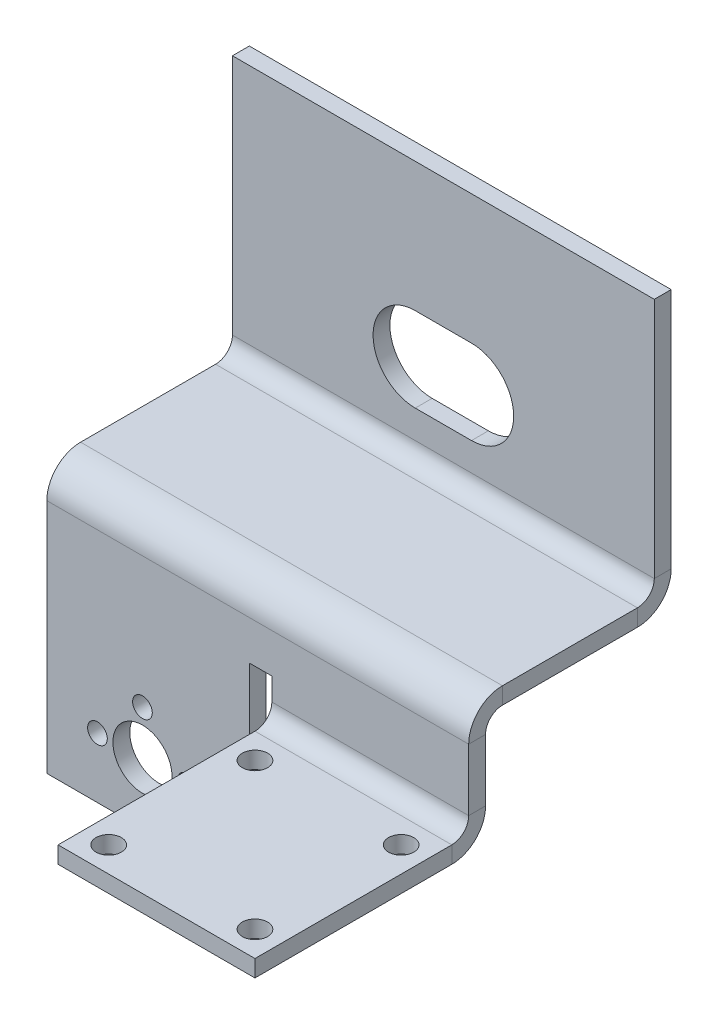
from build123d import *

# Parameters (mm, degrees)
SKETCH1_W                    = 35
SKETCH1_H                    = 35
SKETCH1_R                    = 2.25
BASE_FLANGE1_DEPTH           = 3
EDGE_FLANGE1_DEPTH           = 35
SKETCH9_W                    = 36
SKETCH9_H                    = 35
BOSS_EXTRUDE1_DEPTH          = 3
EDGE_FLANGE2_STRIP_W         = 18
EDGE_FLANGE2_STRIP_H         = 3
EDGE_FLANGE2_STRIP_CUT_DEPTH = 75
EDGE_FLANGE2_DEPTH           = 75
EDGE_FLANGE3_STRIP_W         = 18
EDGE_FLANGE3_STRIP_H         = 3
EDGE_FLANGE3_STRIP_CUT_DEPTH = 75
EDGE_FLANGE3_DEPTH           = 75
SKETCH16_R                   = 5.25
SKETCH16_R_2                 = 1.75
CUT_EXTRUDE1_DEPTH           = 10
CUT_EXTRUDE2_DEPTH           = 10
BODY_MOVE_COPY1_ANGLE        = 180


# Sheet-metal steps are written as plain solids
with BuildPart() as part:
    # Sketch1 → Base-Flange1 (new body)
    with BuildSketch(Plane.XY):
        Rectangle(SKETCH1_W, SKETCH1_H)
        with Locations((-13, 13)):
            Circle(SKETCH1_R, mode=Mode.SUBTRACT)
        with Locations((13, 13)):
            Circle(SKETCH1_R, mode=Mode.SUBTRACT)
        with Locations((13, -13)):
            Circle(SKETCH1_R, mode=Mode.SUBTRACT)
        with Locations((-13, -13)):
            Circle(SKETCH1_R, mode=Mode.SUBTRACT)
    extrude(amount=-BASE_FLANGE1_DEPTH)

    # Edge-Flange1 section (across the edge) → Edge-Flange1 (add)
    with BuildSketch(Plane(origin=(-17.5, -20.5, 0), x_dir=(0, 1, 0), z_dir=(1, 0, 0))):
        with BuildLine():
            Line((-3, 3), (-3, 17))
            Line((-3, 17), (0, 17))
            Line((0, 17), (0, 3))
            ThreePointArc((0, 3), (0.878679656, 0.878679656), (3, 0))
            Line((3, 0), (3, -3))
            ThreePointArc((3, -3), (-1.242640687, -1.242640687), (-3, 3))
        make_face()
    extrude(amount=EDGE_FLANGE1_DEPTH)

    # Sketch9 → Boss-Extrude1 (add)
    with BuildSketch(Plane.XZ.offset(23.5)):
        Polygon((57.5, 17), (17.5, 17), (17.5, 7), (21.5, 7), (57.5, 7), align=None)
        with Locations((39.5, -10.5)):
            Rectangle(SKETCH9_W, SKETCH9_H)
    extrude(amount=-BOSS_EXTRUDE1_DEPTH)

    # Edge-Flange2 strip (across the edge) → Edge-Flange2 strip cut (cut)
    with BuildSketch(Plane(origin=(57.5, -23.5, 17), x_dir=(0, 0, -1), z_dir=(-1, 0, 0))):
        with Locations((-6, -1.5)):
            Rectangle(EDGE_FLANGE2_STRIP_W, EDGE_FLANGE2_STRIP_H)
    extrude(amount=EDGE_FLANGE2_STRIP_CUT_DEPTH, mode=Mode.SUBTRACT)

    # Edge-Flange2 section (across the edge) → Edge-Flange2 (add)
    with BuildSketch(Plane(origin=(57.5, -23.5, 17), x_dir=(0, 0, -1), z_dir=(-1, 0, 0))):
        with BuildLine():
            Line((-3, 3), (-3, 30))
            Line((-3, 30), (0, 30))
            Line((0, 30), (0, 3))
            ThreePointArc((0, 3), (0.878679656, 0.878679656), (3, 0))
            Line((3, 0), (3, -3))
            ThreePointArc((3, -3), (-1.242640687, -1.242640687), (-3, 3))
        make_face()
    extrude(amount=EDGE_FLANGE2_DEPTH)

    # Edge-Flange3 strip (across the edge) → Edge-Flange3 strip cut (cut)
    with BuildSketch(Plane(origin=(-17.5, -53.5, 20), x_dir=(0, 1, 0), z_dir=(1, 0, 0))):
        with Locations((-6, -1.5)):
            Rectangle(EDGE_FLANGE3_STRIP_W, EDGE_FLANGE3_STRIP_H)
    extrude(amount=EDGE_FLANGE3_STRIP_CUT_DEPTH, mode=Mode.SUBTRACT)

    # Edge-Flange3 section (across the edge) → Edge-Flange3 (add)
    with BuildSketch(Plane(origin=(-17.5, -53.5, 20), x_dir=(0, 1, 0), z_dir=(1, 0, 0))):
        with BuildLine():
            Line((-3, 3), (-3, 46))
            Line((-3, 46), (0, 46))
            Line((0, 46), (0, 3))
            ThreePointArc((0, 3), (0.878679656, 0.878679656), (3, 0))
            Line((3, 0), (3, -3))
            ThreePointArc((3, -3), (-1.242640687, -1.242640687), (-3, 3))
        make_face()
    extrude(amount=EDGE_FLANGE3_DEPTH)

    # Sketch16 → Cut-Extrude1 (cut)
    with BuildSketch(Plane(origin=(0, -20.5, 0), x_dir=(1, 0, 0), z_dir=(0, 1, 0))):
        with Locations(Location((40.5, 17.3, 0), (0, 0, 270))):
            Circle(SKETCH16_R)
        with Locations(Location((40.5, 9.3, 0), (0, 0, 270))):
            Circle(SKETCH16_R_2)
        with Locations(Location((48.5, 17.3, 0), (0, 0, 270))):
            Circle(SKETCH16_R_2)
        with Locations(Location((32.5, 17.3, 0), (0, 0, 270))):
            Circle(SKETCH16_R_2)
    extrude(amount=-CUT_EXTRUDE1_DEPTH, mode=Mode.SUBTRACT)

    # Sketch17 → Cut-Extrude2 (cut)
    with BuildSketch(Plane(origin=(0, -53.5, 0), x_dir=(1, 0, 0), z_dir=(0, 1, 0))):
        with BuildLine():
            Line((25, -43), (15, -43))
            ThreePointArc((15, -43), (7.5, -35.5), (15, -28))
            Line((15, -28), (25, -28))
            ThreePointArc((25, -28), (32.5, -35.5), (25, -43))
        make_face()
    extrude(amount=-CUT_EXTRUDE2_DEPTH, mode=Mode.SUBTRACT)


with BuildPart() as part_1:
    # Body-Move/Copy1: moved
    add(part.part.moved(Location((0, 0, 0))).rotate(Axis((20, -19.25, 19.25), (-4.937700262163626e-15, 0.7071067811864181, 0.707106781186677)), BODY_MOVE_COPY1_ANGLE))


solid = part_1.part
